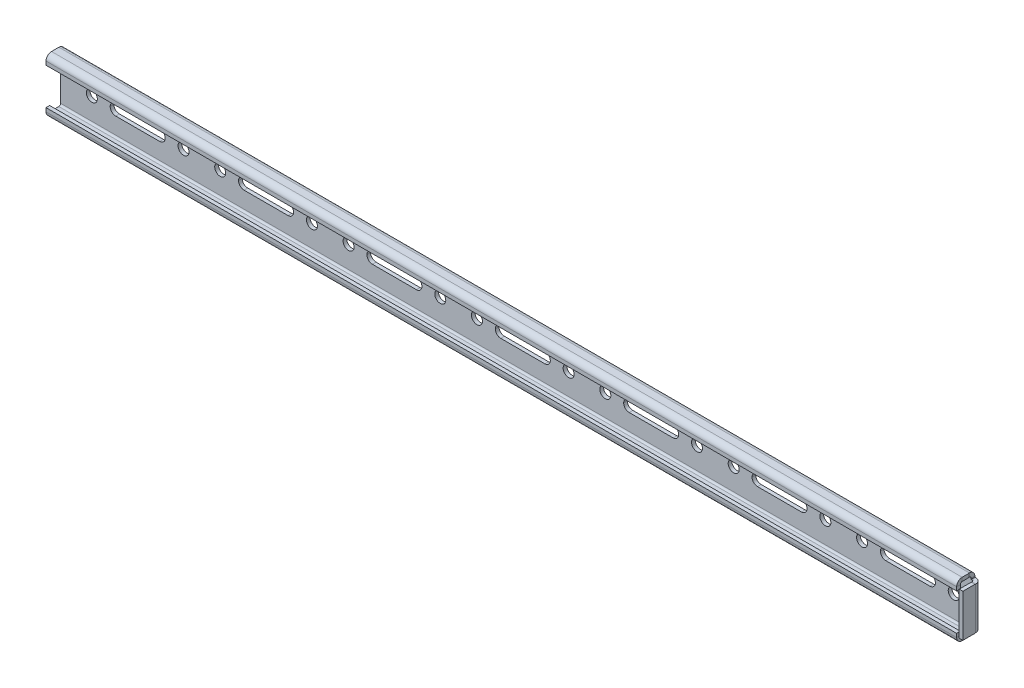
from build123d import *

# Parameters (mm, degrees)
SKETCH2_W                      = 500
SKETCH2_H                      = 30
BOSS_EXTRUDE1_DEPTH            = 10
CONVERT_SOLID1_START           = -500
CONVERT_SOLID1_DEPTH           = 497
CONVERT_SOLID1_START_2         = -3.414213562
CONVERT_SOLID1_2_DEPTH         = 3.414213562
CONVERT_SOLID1_START_3         = -3.5
CONVERT_SOLID1_3_DEPTH         = 0.085786438
CONVERT_SOLID1_START_4         = 290.130873959
CONVERT_SOLID1_4_DEPTH         = 23.171572876
EDGE_FLANGE1_STRIP_W           = 10
EDGE_FLANGE1_STRIP_H           = 2
EDGE_FLANGE1_STRIP_CUT_DEPTH   = 496.585786438
EDGE_FLANGE1_STRIP_2_W         = 10
EDGE_FLANGE1_STRIP_2_H         = 2
EDGE_FLANGE1_STRIP_CUT_2_DEPTH = 496.585786438
EDGE_FLANGE1_DEPTH             = 496.585786438
EDGE_FLANGE1_BEND_DEPTH        = 496.585786438
CUT_EXTRUDE1_DEPTH             = 592.923511083
CUT_EXTRUDE1_DEPTH_BACK        = 592.923511083
SKETCH43_R                     = 3


with BuildPart() as part:
    # Sketch2 → Boss-Extrude1 (new body)
    with BuildSketch(Plane.XY):
        with Locations((-250, 301.716660397)):
            Rectangle(SKETCH2_W, SKETCH2_H)
    extrude(amount=BOSS_EXTRUDE1_DEPTH)

    # Convert-Solid1: read off the stored shape, not the designer's step
    # Convert-Solid1 outline → Convert-Solid1 (cut)
    with BuildSketch(Plane.YZ.offset(CONVERT_SOLID1_START)):
        with BuildLine():
            Line((314.716660397, 3), (314.716660397, 10))
            Line((314.716660397, 10), (288.716660397, 10))
            Line((288.716660397, 10), (288.716660397, 3))
            ThreePointArc((288.716660397, 3), (289.009553616, 2.292893219), (289.716660397, 2))
            Line((289.716660397, 2), (313.716660397, 2))
            ThreePointArc((313.716660397, 2), (314.423767178, 2.292893219), (314.716660397, 3))
        make_face()
        with BuildLine():
            Line((316.716660397, 0), (316.716660397, 3))
            ThreePointArc((316.716660397, 3), (315.837980741, 0.878679656), (313.716660397, 0))
            Line((313.716660397, 0), (316.716660397, 0))
        make_face()
        with BuildLine():
            Line((286.716660397, 0), (289.716660397, 0))
            ThreePointArc((289.716660397, 0), (287.595340053, 0.878679656), (286.716660397, 3))
            Line((286.716660397, 3), (286.716660397, 0))
        make_face()
    extrude(amount=CONVERT_SOLID1_DEPTH, mode=Mode.SUBTRACT)

    # Convert-Solid1 2 outline → Convert-Solid1 2 (cut)
    with BuildSketch(Plane.YZ.offset(CONVERT_SOLID1_START_2)):
        Polygon((316.716660397, 10), (313.302446835, 10), (313.302446835, 3.5), (313.216660397, 3.5), (313.216660397, 0), (316.716660397, 0), align=None)
        Polygon((290.130873959, 3.5), (290.130873959, 10), (286.716660397, 10), (286.716660397, 0), (290.216660397, 0), (290.216660397, 3.5), align=None)
    extrude(amount=CONVERT_SOLID1_2_DEPTH, mode=Mode.SUBTRACT)

    # Convert-Solid1 3 outline → Convert-Solid1 3 (cut)
    with BuildSketch(Plane.YZ.offset(CONVERT_SOLID1_START_3)):
        with BuildLine():
            Line((316.716660397, 3.5), (314.716660397, 3.5))
            Line((314.716660397, 3.5), (314.716660397, 3))
            ThreePointArc((314.716660397, 3), (314.423767178, 2.292893219), (313.716660397, 2))
            Line((313.716660397, 2), (313.216660397, 2))
            Line((313.216660397, 2), (313.216660397, 0))
            Line((313.216660397, 0), (313.716660397, 0))
            ThreePointArc((313.716660397, 0), (315.837980741, 0.878679656), (316.716660397, 3))
            Line((316.716660397, 3), (316.716660397, 3.5))
        make_face()
        with BuildLine():
            Line((290.216660397, 0), (290.216660397, 2))
            Line((290.216660397, 2), (289.716660397, 2))
            ThreePointArc((289.716660397, 2), (289.009553616, 2.292893219), (288.716660397, 3))
            Line((288.716660397, 3), (288.716660397, 3.5))
            Line((288.716660397, 3.5), (286.716660397, 3.5))
            Line((286.716660397, 3.5), (286.716660397, 3))
            ThreePointArc((286.716660397, 3), (287.595340053, 0.878679656), (289.716660397, 0))
            Line((289.716660397, 0), (290.216660397, 0))
        make_face()
    extrude(amount=CONVERT_SOLID1_3_DEPTH, mode=Mode.SUBTRACT)

    # Convert-Solid1 4 outline → Convert-Solid1 4 (cut)
    with BuildSketch(Plane(origin=(0, 0, 0), x_dir=(1, 0, 0), z_dir=(0, 1, 0)).offset(CONVERT_SOLID1_START_4)):
        with BuildLine():
            ThreePointArc((-3, 0), (-0.878679656, -0.878679656), (0, -3))
            Line((0, -3), (0, 0))
            Line((0, 0), (-3, 0))
        make_face()
        with BuildLine():
            Line((-3, -2), (-3, -10))
            Line((-3, -10), (-2, -10))
            Line((-2, -10), (-2, -3))
            ThreePointArc((-2, -3), (-2.292893219, -2.292893219), (-3, -2))
        make_face()
    extrude(amount=CONVERT_SOLID1_4_DEPTH, mode=Mode.SUBTRACT)

    # Edge-Flange1: sheet metal written as solids
    # Edge-Flange1 strip (on a plane across the edge) → Edge-Flange1 strip cut (cut)
    with BuildSketch(Plane(origin=(-3.414213562, 314.716660397, 10), x_dir=(0, 0, -1), z_dir=(-1, 0, 0))):
        with Locations((-2, -1)):
            Rectangle(EDGE_FLANGE1_STRIP_W, EDGE_FLANGE1_STRIP_H)
    extrude(amount=EDGE_FLANGE1_STRIP_CUT_DEPTH, mode=Mode.SUBTRACT)

    # Edge-Flange1 strip 2 (on a plane across the edge) → Edge-Flange1 strip cut 2 (cut)
    with BuildSketch(Plane(origin=(-500, 288.716660397, 10), x_dir=(0, 0, -1), z_dir=(1, 0, 0))):
        with Locations((-2, -1)):
            Rectangle(EDGE_FLANGE1_STRIP_2_W, EDGE_FLANGE1_STRIP_2_H)
    extrude(amount=EDGE_FLANGE1_STRIP_CUT_2_DEPTH, mode=Mode.SUBTRACT)

    # Edge-Flange1 section (on a plane across the edge) → Edge-Flange1 (add)
    with BuildSketch(Plane(origin=(-3.414213562, 314.716660397, 10), x_dir=(0, 0, -1), z_dir=(-1, 0, 0))):
        with BuildLine():
            Line((0, 1), (0, 3))
            Line((0, 3), (2, 3))
            Line((2, 3), (2, 1))
            ThreePointArc((2, 1), (2.292893219, 0.292893219), (3, 0))
            Line((3, 0), (3, -2))
            ThreePointArc((3, -2), (0.878679656, -1.121320344), (0, 1))
        make_face()
    extrude(amount=EDGE_FLANGE1_DEPTH)

    # Edge-Flange1 section 2 (on a plane across the edge) → Edge-Flange1 bend (add)
    with BuildSketch(Plane(origin=(-500, 288.716660397, 10), x_dir=(0, 0, -1), z_dir=(1, 0, 0))):
        with BuildLine():
            Line((0, 1), (0, 3))
            Line((0, 3), (2, 3))
            Line((2, 3), (2, 1))
            ThreePointArc((2, 1), (2.292893219, 0.292893219), (3, 0))
            Line((3, 0), (3, -2))
            ThreePointArc((3, -2), (0.878679656, -1.121320344), (0, 1))
        make_face()
    extrude(amount=EDGE_FLANGE1_BEND_DEPTH)

    # Sketch43 → Cut-Extrude1 (cut, two sides: drawn at the far end of the back side and taken through both)
    with BuildSketch(Plane.XY.offset(2).offset(-CUT_EXTRUDE1_DEPTH_BACK)):
        with Locations((-63, 301.726660397)):
            Circle(SKETCH43_R)
        with Locations((-13, 301.726660397)):
            Circle(SKETCH43_R)
        with Locations((-133, 301.726660397)):
            Circle(SKETCH43_R)
        with Locations((-83, 301.726660397)):
            Circle(SKETCH43_R)
        with Locations((-203, 301.726660397)):
            Circle(SKETCH43_R)
        with Locations((-153, 301.726660397)):
            Circle(SKETCH43_R)
        with Locations((-273, 301.726660397)):
            Circle(SKETCH43_R)
        with Locations((-223, 301.726660397)):
            Circle(SKETCH43_R)
        with Locations((-343, 301.726660397)):
            Circle(SKETCH43_R)
        with Locations((-293, 301.726660397)):
            Circle(SKETCH43_R)
        with Locations((-413, 301.726660397)):
            Circle(SKETCH43_R)
        with Locations((-363, 301.726660397)):
            Circle(SKETCH43_R)
        with Locations((-483, 301.726660397)):
            Circle(SKETCH43_R)
        with Locations((-433, 301.726660397)):
            Circle(SKETCH43_R)
        with BuildLine():
            Line((-25.99, 304.726660397), (-50.01, 304.726660397))
            ThreePointArc((-50.01, 304.726660397), (-52.124249276, 303.850909673), (-53, 301.736660397))
            Line((-53, 301.736660397), (-53, 301.716660397))
            ThreePointArc((-53, 301.716660397), (-52.124249276, 299.602411121), (-50.01, 298.726660397))
            Line((-50.01, 298.726660397), (-25.99, 298.726660397))
            ThreePointArc((-25.99, 298.726660397), (-23.875750724, 299.602411121), (-23, 301.716660397))
            Line((-23, 301.716660397), (-23, 301.736660397))
            ThreePointArc((-23, 301.736660397), (-23.875750724, 303.850909673), (-25.99, 304.726660397))
        make_face()
        with BuildLine():
            Line((-93, 301.736660397), (-93, 301.716660397))
            ThreePointArc((-93, 301.716660397), (-93.875750724, 299.602411121), (-95.99, 298.726660397))
            Line((-95.99, 298.726660397), (-120.01, 298.726660397))
            ThreePointArc((-120.01, 298.726660397), (-122.124249276, 299.602411121), (-123, 301.716660397))
            Line((-123, 301.716660397), (-123, 301.736660397))
            ThreePointArc((-123, 301.736660397), (-122.124249276, 303.850909673), (-120.01, 304.726660397))
            Line((-120.01, 304.726660397), (-95.99, 304.726660397))
            ThreePointArc((-95.99, 304.726660397), (-93.875750724, 303.850909673), (-93, 301.736660397))
        make_face()
        with BuildLine():
            Line((-163, 301.736660397), (-163, 301.716660397))
            ThreePointArc((-163, 301.716660397), (-163.875750724, 299.602411121), (-165.99, 298.726660397))
            Line((-165.99, 298.726660397), (-190.01, 298.726660397))
            ThreePointArc((-190.01, 298.726660397), (-192.124249276, 299.602411121), (-193, 301.716660397))
            Line((-193, 301.716660397), (-193, 301.736660397))
            ThreePointArc((-193, 301.736660397), (-192.124249276, 303.850909673), (-190.01, 304.726660397))
            Line((-190.01, 304.726660397), (-165.99, 304.726660397))
            ThreePointArc((-165.99, 304.726660397), (-163.875750724, 303.850909673), (-163, 301.736660397))
        make_face()
        with BuildLine():
            Line((-233, 301.736660397), (-233, 301.716660397))
            ThreePointArc((-233, 301.716660397), (-233.875750724, 299.602411121), (-235.99, 298.726660397))
            Line((-235.99, 298.726660397), (-260.01, 298.726660397))
            ThreePointArc((-260.01, 298.726660397), (-262.124249276, 299.602411121), (-263, 301.716660397))
            Line((-263, 301.716660397), (-263, 301.736660397))
            ThreePointArc((-263, 301.736660397), (-262.124249276, 303.850909673), (-260.01, 304.726660397))
            Line((-260.01, 304.726660397), (-235.99, 304.726660397))
            ThreePointArc((-235.99, 304.726660397), (-233.875750724, 303.850909673), (-233, 301.736660397))
        make_face()
        with BuildLine():
            Line((-303, 301.736660397), (-303, 301.716660397))
            ThreePointArc((-303, 301.716660397), (-303.875750724, 299.602411121), (-305.99, 298.726660397))
            Line((-305.99, 298.726660397), (-330.01, 298.726660397))
            ThreePointArc((-330.01, 298.726660397), (-332.124249276, 299.602411121), (-333, 301.716660397))
            Line((-333, 301.716660397), (-333, 301.736660397))
            ThreePointArc((-333, 301.736660397), (-332.124249276, 303.850909673), (-330.01, 304.726660397))
            Line((-330.01, 304.726660397), (-305.99, 304.726660397))
            ThreePointArc((-305.99, 304.726660397), (-303.875750724, 303.850909673), (-303, 301.736660397))
        make_face()
        with BuildLine():
            Line((-373, 301.736660397), (-373, 301.716660397))
            ThreePointArc((-373, 301.716660397), (-373.875750724, 299.602411121), (-375.99, 298.726660397))
            Line((-375.99, 298.726660397), (-400.01, 298.726660397))
            ThreePointArc((-400.01, 298.726660397), (-402.124249276, 299.602411121), (-403, 301.716660397))
            Line((-403, 301.716660397), (-403, 301.736660397))
            ThreePointArc((-403, 301.736660397), (-402.124249276, 303.850909673), (-400.01, 304.726660397))
            Line((-400.01, 304.726660397), (-375.99, 304.726660397))
            ThreePointArc((-375.99, 304.726660397), (-373.875750724, 303.850909673), (-373, 301.736660397))
        make_face()
        with BuildLine():
            Line((-443, 301.736660397), (-443, 301.716660397))
            ThreePointArc((-443, 301.716660397), (-443.875750724, 299.602411121), (-445.99, 298.726660397))
            Line((-445.99, 298.726660397), (-470.01, 298.726660397))
            ThreePointArc((-470.01, 298.726660397), (-472.124249276, 299.602411121), (-473, 301.716660397))
            Line((-473, 301.716660397), (-473, 301.736660397))
            ThreePointArc((-473, 301.736660397), (-472.124249276, 303.850909673), (-470.01, 304.726660397))
            Line((-470.01, 304.726660397), (-445.99, 304.726660397))
            ThreePointArc((-445.99, 304.726660397), (-443.875750724, 303.850909673), (-443, 301.736660397))
        make_face()
    extrude(amount=CUT_EXTRUDE1_DEPTH + CUT_EXTRUDE1_DEPTH_BACK, mode=Mode.SUBTRACT)


solid = part.part
